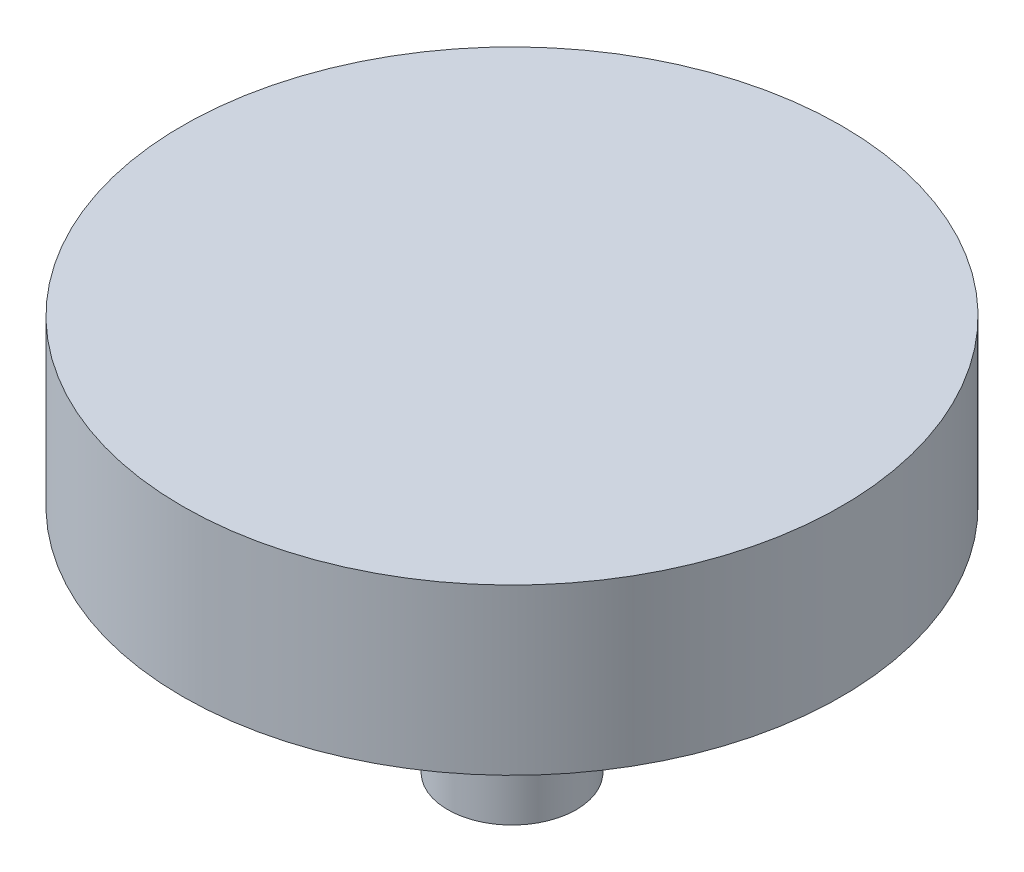
from build123d import *

# Parameters (mm, degrees)
SKETCH1_R           = 10
BOSS_EXTRUDE1_DEPTH = 5
SKETCH2_R           = 1.95
BOSS_EXTRUDE2_DEPTH = 7


with BuildPart() as part:
    # Sketch1 → Boss-Extrude1 (new body)
    with BuildSketch(Plane(origin=(-645.719089615, 0, 411.175989112), x_dir=(-0.4230025267803184, 0, 0.9061285021107469), z_dir=(0, -1, 0))):
        with Locations((52.987730107, -483.544948633)):
            Circle(SKETCH1_R)
    extrude(amount=BOSS_EXTRUDE1_DEPTH)

    # Sketch2 → Boss-Extrude2 (add)
    with BuildSketch(Plane(origin=(0, -5, 0), x_dir=(-0.42300252678031874, 0, 0.9061285021107468), z_dir=(0, -1, 0))):
        with Locations((698.706819722, -72.368959522)):
            Circle(SKETCH2_R)
    extrude(amount=BOSS_EXTRUDE2_DEPTH)


solid = part.part
